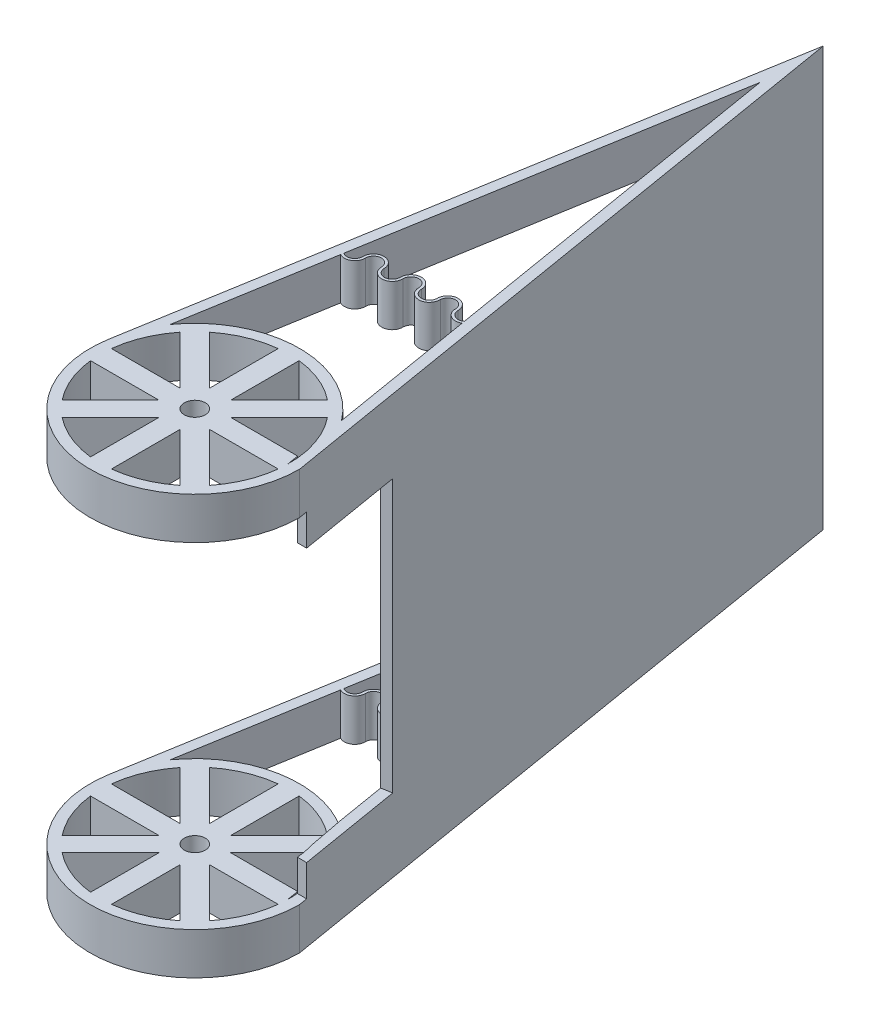
from build123d import *

# Parameters (mm, degrees)
SKETCH1_R           = 1
BOSS_EXTRUDE1_DEPTH = 40
CUT_EXTRUDE2_DEPTH  = 16
SKETCH5_W           = 10
SKETCH5_H           = 26
CUT_EXTRUDE3_DEPTH  = 12.75
BOSS_EXTRUDE2_DEPTH = 4


with BuildPart() as part:
    # Sketch1 → Boss-Extrude1 (new body)
    with BuildSketch(Plane(origin=(0, 0, 0), x_dir=(1, 0, 0), z_dir=(0, 1, 0))):
        with BuildLine():
            Line((10, 0), (0, 60))
            Line((0, 60), (-9.860132972, 1.666666667))
            ThreePointArc((-9.860132972, 1.666666667), (-0.836262603, -9.964971895), (10, 0))
        make_face()
        Circle(SKETCH1_R, mode=Mode.SUBTRACT)
        with BuildLine():
            Line((-1, 8.959471052), (-1, 2.414213562))
            Line((-1, 2.414213562), (-5.628195955, 7.042409518))
            ThreePointArc((-5.628195955, 7.042409518), (-3.449931396, 8.328871165), (-1, 8.959471052))
        make_face(mode=Mode.SUBTRACT)
        with BuildLine():
            Line((-7.042409518, 5.628195955), (-2.414213562, 1))
            Line((-2.414213562, 1), (-8.959471052, 1))
            ThreePointArc((-8.959471052, 1), (-8.328871165, 3.449931396), (-7.042409518, 5.628195955))
        make_face(mode=Mode.SUBTRACT)
        with BuildLine():
            Line((1, 2.414213562), (1, 8.959471052))
            ThreePointArc((1, 8.959471052), (3.449931396, 8.328871165), (5.628195955, 7.042409518))
            Line((5.628195955, 7.042409518), (1, 2.414213562))
        make_face(mode=Mode.SUBTRACT)
        with BuildLine():
            Line((-8.147636517, 5.797932319), (-0.006945449, 53.958910167))
            Line((-0.006945449, 53.958910167), (7.982280685, 6.023553358))
            ThreePointArc((7.982280685, 6.023553358), (-0.139863688, 9.99902186), (-8.147636517, 5.797932319))
        make_face(mode=Mode.SUBTRACT)
        with BuildLine():
            Line((2.414213562, 1), (7.042409518, 5.628195955))
            ThreePointArc((7.042409518, 5.628195955), (8.328871165, 3.449931396), (8.959471052, 1))
            ThreePointArc((8.959471052, 1), (9.005377927, 0.418676383), (9.013606076, -0.164398987))
            Line((9.013606076, -0.164398987), (8.819539578, 1))
            Line((8.819539578, 1), (2.414213562, 1))
        make_face(mode=Mode.SUBTRACT)
        with BuildLine():
            Line((-8.959471052, -1), (-2.414213562, -1))
            Line((-2.414213562, -1), (-7.042409518, -5.628195955))
            ThreePointArc((-7.042409518, -5.628195955), (-8.328871165, -3.449931396), (-8.959471052, -1))
        make_face(mode=Mode.SUBTRACT)
        with BuildLine():
            ThreePointArc((-1, -8.959471052), (-3.449931396, -8.328871165), (-5.628195955, -7.042409518))
            Line((-5.628195955, -7.042409518), (-1, -2.414213562))
            Line((-1, -2.414213562), (-1, -8.959471052))
        make_face(mode=Mode.SUBTRACT)
        with BuildLine():
            ThreePointArc((5.628195955, -7.042409518), (3.449931396, -8.328871165), (1, -8.959471052))
            Line((1, -8.959471052), (1, -2.414213562))
            Line((1, -2.414213562), (5.628195955, -7.042409518))
        make_face(mode=Mode.SUBTRACT)
        with BuildLine():
            ThreePointArc((8.959471052, -1), (8.328871165, -3.449931396), (7.042409518, -5.628195955))
            Line((7.042409518, -5.628195955), (2.414213562, -1))
            Line((2.414213562, -1), (8.959471052, -1))
        make_face(mode=Mode.SUBTRACT)
    extrude(amount=BOSS_EXTRUDE1_DEPTH)

    # Sketch4 → Cut-Extrude2 (cut, symmetric)
    with BuildSketch(Plane(origin=(0, 20, 0), x_dir=(-1, 0, 0), z_dir=(0, -1, 0))):
        Polygon((-8.877415303, 1.341770275), (-8.978243143, 0.814414874), (-12.501432649, 0.814414874), (-12.501432649, -9.874000046), (27.256185967, -11.315556265), (27.256185967, 53.958910167), (0.006945449, 53.958910167), (-7.982280685, 6.023553358), (-8.645423601, 2.555146235), (-8.746251441, 2.027790834), align=None)
    extrude(amount=CUT_EXTRUDE2_DEPTH, both=True, mode=Mode.SUBTRACT)

    # Sketch5 → Cut-Extrude3 (cut, symmetric)
    with BuildSketch(Plane(origin=(9.72972973, 0, -1.621621622), x_dir=(-0.1643989873053573, 0, -0.9863939238321439), z_dir=(0.9863939238321439, 0, -0.1643989873053573))):
        with Locations((4.181658841, 20)):
            Rectangle(SKETCH5_W, SKETCH5_H)
    extrude(amount=CUT_EXTRUDE3_DEPTH, both=True, mode=Mode.SUBTRACT)

    # Sketch6 → Boss-Extrude2 (add)
    with BuildSketch(Plane.XZ):
        with BuildLine():
            Line((-5.794737363, -19.717871437), (-5.749720089, -19.984197223))
            ThreePointArc((-5.749720089, -19.984197223), (-4.964059213, -19.93196472), (-4.56470455, -20.610571454))
            ThreePointArc((-4.56470455, -20.610571454), (-3.58563596, -21.631073632), (-2.565133782, -20.652005041))
            ThreePointArc((-2.565133782, -20.652005041), (-1.79975716, -19.917703584), (-1.065455705, -20.683080209))
            ThreePointArc((-1.065455705, -20.683080209), (-0.07602927, -21.703743341), (0.934329679, -20.703796997))
            ThreePointArc((0.934329679, -20.703796997), (1.684329679, -19.953796997), (2.434329679, -20.703796997))
            ThreePointArc((2.434329679, -20.703796997), (3.434329679, -21.703796997), (4.434329679, -20.703796997))
            ThreePointArc((4.434329679, -20.703796997), (4.849537937, -20.032667732), (5.635434984, -20.104627568))
            Line((5.635434984, -20.104627568), (5.680296948, -19.83545578))
            ThreePointArc((5.680296948, -19.83545578), (4.644652017, -19.86192526), (4.188222104, -20.791942891))
            Line((4.188222104, -20.791942891), (4.179154082, -20.79175499))
            ThreePointArc((4.179154082, -20.79175499), (3.41879209, -21.453636035), (2.68650098, -20.760825378))
            Line((2.68650098, -20.760825378), (2.682706725, -20.760746756))
            ThreePointArc((2.682706725, -20.760746756), (1.712816119, -19.704202818), (0.684329679, -20.703796997))
            ThreePointArc((0.684329679, -20.703796997), (-0.073439528, -21.453756755), (-0.815509359, -20.688259416))
            ThreePointArc((-0.815509359, -20.688259416), (-1.794577953, -19.667757238), (-2.815080128, -20.646825835))
            ThreePointArc((-2.815080128, -20.646825835), (-3.580456755, -21.381127286), (-4.314758204, -20.615750657))
            ThreePointArc((-4.314758204, -20.615750657), (-4.795852319, -19.740072256), (-5.794737363, -19.717871437))
        make_face()
    boss_extrude2 = extrude(amount=-BOSS_EXTRUDE2_DEPTH)

    # Mirror2: Boss-Extrude2 across plane
    add(boss_extrude2.mirror(Plane(origin=(0, 20, 0), x_dir=(0, 0, 1), z_dir=(0, -1, 0))))


solid = part.part
